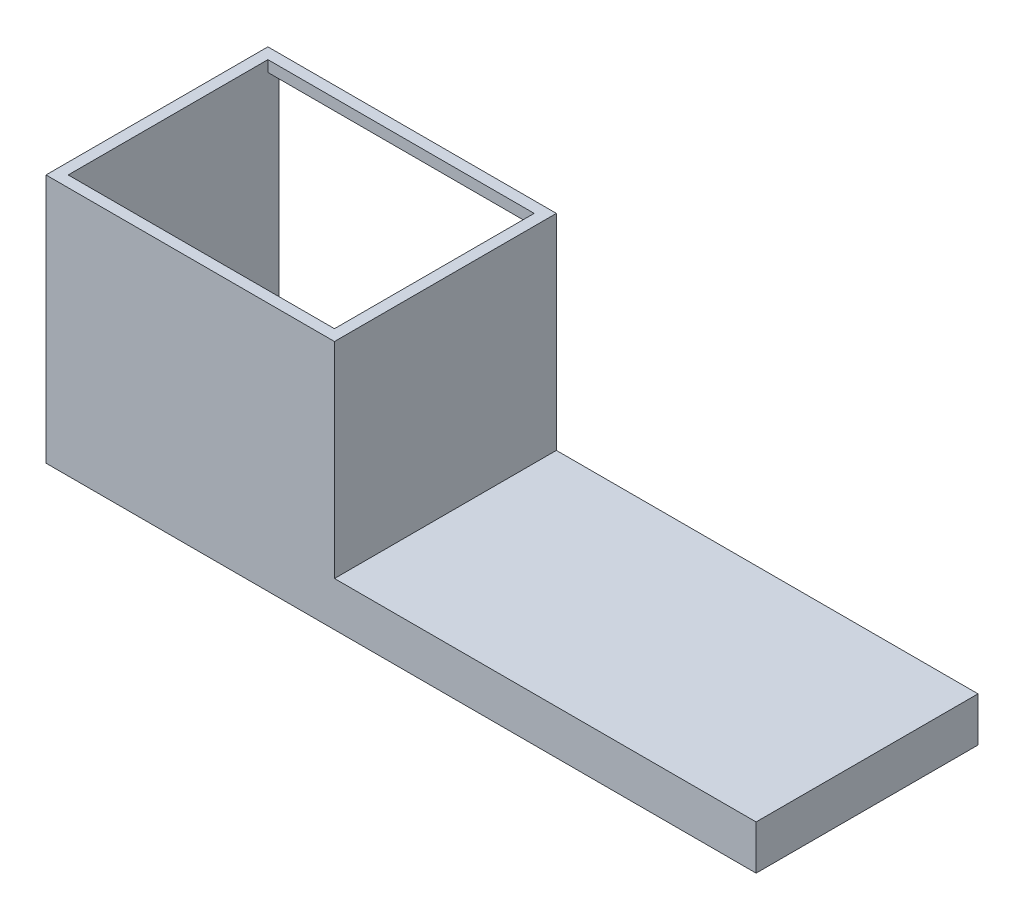
from build123d import *

# Parameters (mm, degrees)
SKETCH1_W             = 64
SKETCH1_H             = 22.5
BODY_DEPTH            = 20
SKETCH2_W             = 38
SKETCH2_H             = 18.5
REMOVE_MATERIAL_DEPTH = 40.377182479
DUCTING_DEPTH         = 19
SKETCH4_W             = 24
SKETCH4_H             = 18
INLET_DEPTH           = 1
SKETCH5_W             = 52
SKETCH5_H             = 18
OUTLET_DEPTH          = 1


with BuildPart() as part:
    # Sketch1 → body (new body)
    with BuildSketch(Plane.XY):
        Rectangle(SKETCH1_W, SKETCH1_H)
    extrude(amount=BODY_DEPTH)

    # Sketch2 → remove_material (cut, through all)
    with BuildSketch(Plane.XY.offset(20)):
        with Locations((13, 2)):
            Rectangle(SKETCH2_W, SKETCH2_H)
    extrude(amount=-REMOVE_MATERIAL_DEPTH, mode=Mode.SUBTRACT)

    # Sketch3 → ducting (cut)
    with BuildSketch(Plane(origin=(0, 0, 0), x_dir=(-1, 0, 0), z_dir=(0, 0, -1))):
        Polygon((31, -10.25), (-31, -10.25), (-31, -8.25), (7, -8.25), (7, 10.25), (31, 10.25), align=None)
    extrude(amount=-DUCTING_DEPTH, mode=Mode.SUBTRACT)

    # Sketch4 → inlet (cut)
    with BuildSketch(Plane(origin=(0, 11.25, 0), x_dir=(1, 0, 0), z_dir=(0, 1, 0))):
        with Locations((-19, -10)):
            Rectangle(SKETCH4_W, SKETCH4_H)
    extrude(amount=-INLET_DEPTH, mode=Mode.SUBTRACT)

    # Sketch5 → outlet (cut)
    with BuildSketch(Plane.XZ.offset(11.25)):
        with Locations((5, 10)):
            Rectangle(SKETCH5_W, SKETCH5_H)
    extrude(amount=-OUTLET_DEPTH, mode=Mode.SUBTRACT)


solid = part.part
